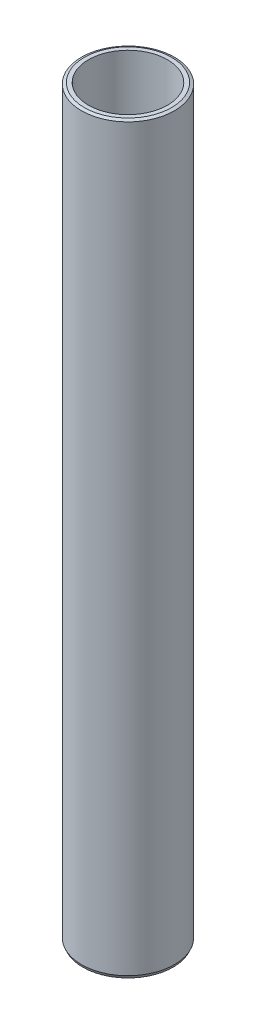
from build123d import *
from OCP.BRepFilletAPI import BRepFilletAPI_MakeChamfer

# Parameters (mm, degrees)
SKETCH1_R           = 37.5
BOSS_EXTRUDE1_DEPTH = 600
SKETCH2_R           = 31.858107545
CUT_EXTRUDE1_DEPTH  = 603.339190158
CHAMFER1_SIZE       = 1.04188389
CHAMFER1_SIZE2      = 2.324327289


with BuildPart() as part:
    # Sketch1 → Boss-Extrude1 (new body)
    with BuildSketch(Plane(origin=(0, 0, 0), x_dir=(1, 0, 0), z_dir=(0, 1, 0))):
        Circle(SKETCH1_R)
    extrude(amount=BOSS_EXTRUDE1_DEPTH)

    # Sketch2 → Cut-Extrude1 (cut, through all)
    with BuildSketch(Plane(origin=(0, 0, 0), x_dir=(1, 0, 0), z_dir=(0, 1, 0))):
        Circle(SKETCH2_R)
    extrude(amount=CUT_EXTRUDE1_DEPTH, mode=Mode.SUBTRACT)

    # Chamfer1: one chamfer whose edges measure the first distance from different faces: ONE call of the kernel's chamfer builder (chamfer() names one face for all edges)
    chamfer1_edges_1 = [part.edges().sort_by_distance(p)[0] for p in [
        (-37.5, 600, 0),
    ]]
    chamfer1_side_1 = [part.faces().sort_by_distance(p)[0] for p in [
        (-37.5, 300, 0),
    ]]
    chamfer1_edges_2 = [part.edges().sort_by_distance(p)[0] for p in [
        (-37.5, 0, 0),
    ]]
    chamfer1_side_2 = [part.faces().sort_by_distance(p)[0] for p in [
        (-36.439339828, 0, 0),
    ]]
    chamfer1 = BRepFilletAPI_MakeChamfer(part.part.solid().wrapped)
    for e in chamfer1_edges_1:
        chamfer1.Add(CHAMFER1_SIZE, CHAMFER1_SIZE2, e.wrapped, chamfer1_side_1[0].wrapped)  # the first distance lies on this face
    for e in chamfer1_edges_2:
        chamfer1.Add(CHAMFER1_SIZE, CHAMFER1_SIZE2, e.wrapped, chamfer1_side_2[0].wrapped)  # the first distance lies on this face
    add(Compound.cast(chamfer1.Shape()), mode=Mode.REPLACE)


solid = part.part
